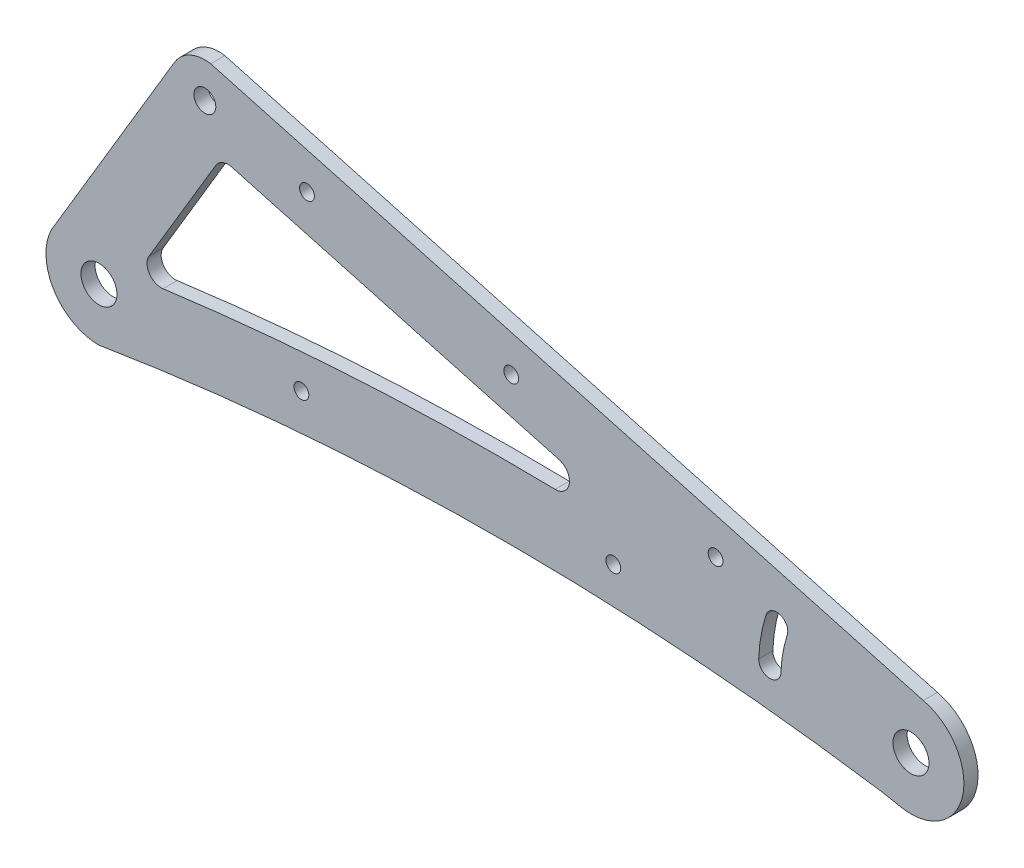
from build123d import *

# Parameters (mm, degrees)
SKETCH_1_R             = 5.1
SKETCH_1_R_2           = 3.1
SM_BASE_FLANGE_1_DEPTH = 4
SKETCH_29_R            = 2.1
CUT_EXTRUDE_7_DEPTH    = 10
CUT_EXTRUDE_11_DEPTH   = 10


# Sheet-metal steps are written as plain solids
with BuildPart() as part:
    # Sketch 1 → Базовая кромка1 (new body)
    with BuildSketch(Plane.XY):
        with BuildLine():
            Line((21.416256147, 65.130237954), (-13.484101554, 6.571073374))
            ThreePointArc((-13.484101554, 6.571073374), (-12.719396617, -7.950908734), (0, -15))
            ThreePointArc((0, -15), (110.130832642, -5.633175847), (220.379871586, -13.487289734))
            ThreePointArc((220.379871586, -13.487289734), (223.626784147, -14.026708962), (226.855383886, -14.666676157))
            ThreePointArc((226.855383886, -14.666676157), (228.418883679, -14.916436276), (230, -15))
            ThreePointArc((230, -15), (244.896230479, -1.761339697), (233.49830961, 14.586357663))
            Line((233.49830961, 14.586357663), (31.656582874, 69.861832141))
            ThreePointArc((31.656582874, 69.861832141), (25.805552993, 69.077808893), (21.416256147, 65.130237954))
        make_face()
        Circle(SKETCH_1_R, mode=Mode.SUBTRACT)
        with Locations((230, 0)):
            Circle(SKETCH_1_R, mode=Mode.SUBTRACT)
        with Locations((30, 60)):
            Circle(SKETCH_1_R_2, mode=Mode.SUBTRACT)
        with BuildLine():
            Line((37.603385022, 47.496856423), (130.332311604, 22.102526432))
            ThreePointArc((130.332311604, 22.102526432), (133.234743351, 17.673003854), (129.197928501, 14.245336107))
            ThreePointArc((129.197928501, 14.245336107), (73.556484101, 13.205174657), (18.156304087, 7.92574997))
            ThreePointArc((18.156304087, 7.92574997), (14.286499385, 9.687372505), (14.189161482, 13.938163928))
            Line((14.189161482, 13.938163928), (33.110820822, 45.686737192))
            ThreePointArc((33.110820822, 45.686737192), (35.05198474, 47.349074558), (37.603385022, 47.496856423))
        make_face(mode=Mode.SUBTRACT)
    extrude(amount=-SM_BASE_FLANGE_1_DEPTH)

    # Эскиз29 → Вырез-Вытянуть7 (cut)
    with BuildSketch(Plane.XY):
        with Locations((116.790365799, 36.179268785)):
            Circle(SKETCH_29_R)
        with Locations((174.659589105, 20.331461556)):
            Circle(SKETCH_29_R)
        with Locations((58.921142493, 52.027076013)):
            Circle(SKETCH_29_R)
        with Locations((57.341971973, 2.442823407)):
            Circle(SKETCH_29_R)
        with Locations((145.69468633, 4.101167629)):
            Circle(SKETCH_29_R)
    extrude(amount=-CUT_EXTRUDE_7_DEPTH, mode=Mode.SUBTRACT)

    # Эскиз47 → Вырез-Вытянуть11 (cut)
    with BuildSketch(Plane.XY):
        with BuildLine():
            ThreePointArc((186.876285814, 1.505913283), (189.914433505, -1.752101237), (193.172448024, 1.286046453))
            ThreePointArc((193.172448024, 1.286046453), (193.709834302, 6.398935347), (194.953567375, 11.387276243))
            ThreePointArc((194.953567375, 11.387276243), (192.93114288, 15.356507801), (188.961911322, 13.334083307))
            ThreePointArc((188.961911322, 13.334083307), (187.505545458, 7.492918866), (186.876285814, 1.505913283))
        make_face()
    extrude(amount=-CUT_EXTRUDE_11_DEPTH, mode=Mode.SUBTRACT)


solid = part.part
